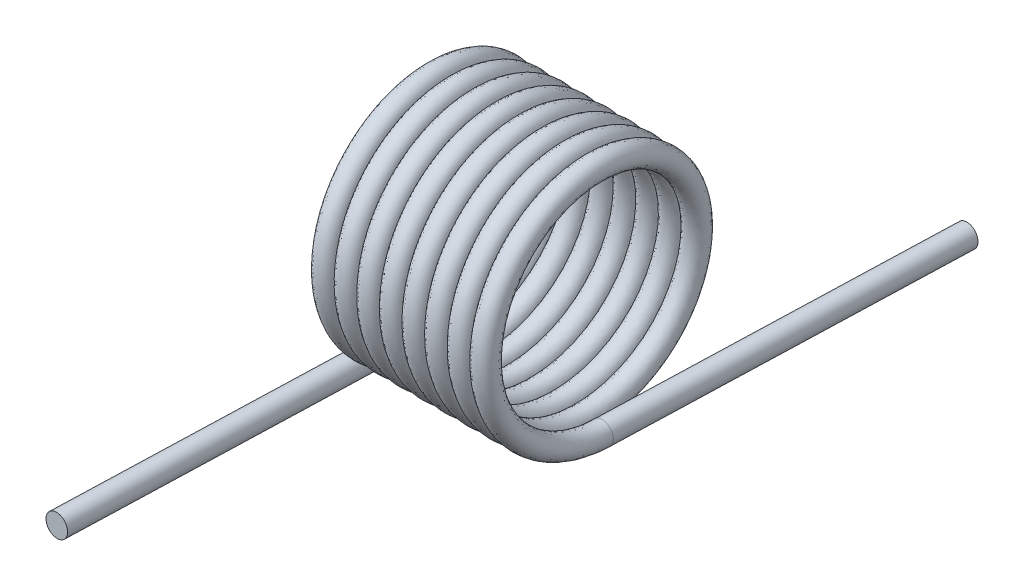
from build123d import *

# Parameters (mm, degrees)
SWEEP1_PITCH   = 2.4384
SKETCH3_R      = 1.2065
EXTRUDE1_DEPTH = 38.1
SKETCH4_R      = 1.2065
EXTRUDE2_DEPTH = 38.1


with BuildPart() as part:
    # Sweep1: the profile of Sketch2 screwed along a right-hand helix of 8 turns, 6 arcs to a turn; built about Z, then put on its axis
    sweep1_z = Axis((0, 0, 0), (0, 0, 1))
    sweep1_corners = [(11.9761, 0.039075909, -1.205867042), (10.7696, 0, 0), (11.9761, -0.039075909, 1.205867042), (13.1826, 0, 0)]
    with BuildLine(mode=Mode.PRIVATE) as sweep1_profile:
        ThreePointArc((11.9761, 0.039075909, -1.205867042), (11.122975668, 0.02763084, -0.852676763), (10.7696, 0, 0))
        ThreePointArc((10.7696, 0, 0), (11.122975668, -0.02763084, 0.852676763), (11.9761, -0.039075909, 1.205867042))
        ThreePointArc((11.9761, -0.039075909, 1.205867042), (12.829224332, -0.02763084, 0.852676763), (13.1826, 0, 0))
        ThreePointArc((13.1826, 0, 0), (12.829224332, 0.02763084, -0.852676763), (11.9761, 0.039075909, -1.205867042))
    sweep1_cap = Face(sweep1_profile.wire())
    sweep1_arcs = [((11.9761, 0.039075909, -1.205867042), (10.7696, 0.039075909, -1.205867042), (10.7696, 0, 0), (1, 0.7071067811865476, 1)), ((10.7696, 0, 0), (10.7696, -0.039075909, 1.205867042), (11.9761, -0.039075909, 1.205867042), (1, 0.7071067811865476, 1)), ((11.9761, -0.039075909, 1.205867042), (13.1826, -0.039075909, 1.205867042), (13.1826, 0, 0), (1, 0.7071067811865476, 1)), ((13.1826, 0, 0), (13.1826, 0.039075909, -1.205867042), (11.9761, 0.039075909, -1.205867042), (1, 0.7071067811865476, 1))]  # start, shoulder, end, weights
    sweep1_turn_angles = [0, 30, 60, 90, 120, 150, 180, 210, 240, 270, 300, 330, 360]
    sweep1_turn_weights = [1, 0.8660254037844387, 1, 0.8660254037844387, 1, 0.8660254037844387, 1, 0.8660254037844387, 1, 0.8660254037844387, 1, 0.8660254037844387, 1]
    sweep1_turn_sides = [Face.make_bezier_surface([[Vector(p[j][0], p[j][1], 0).rotate(sweep1_z, sweep1_turn_angles[2 * i + k]) / sweep1_turn_weights[2 * i + k] + Vector(0, 0, p[j][2] + SWEEP1_PITCH * sweep1_turn_angles[2 * i + k] / 360) for k in range(3)] for j in range(3)], [[p[3][j] * sweep1_turn_weights[2 * i + k] for k in range(3)] for j in range(3)]) for p in sweep1_arcs for i in range(6)]
    sweep1 = Plane(origin=(0, 0, 0), x_dir=(0, -1, 0), z_dir=(1, 0, 0)) * Solid(Shell([*[p.moved(Location((0, 0, SWEEP1_PITCH * i))) for i in range(8) for p in sweep1_turn_sides], sweep1_cap, sweep1_cap.rotate(sweep1_z, 2880).moved(Location((0, 0, SWEEP1_PITCH * 2880 / 360)))]))
    add(sweep1)

    # Sketch3 → Extrude1 (add)
    with BuildSketch(Plane(origin=(0, 0, 0), x_dir=(0.9994753768225241, -2.6712355621968785e-14, 0.03238782372240541), z_dir=(-0.03238782372240541, -1.0018023229831609e-14, 0.9994753768225241))):
        with Locations(Location((0, -11.9761, 0), (0, 0, 180))):
            Circle(SKETCH3_R)
    extrude(amount=EXTRUDE1_DEPTH)

    # Sketch4 → Extrude2 (add)
    with BuildSketch(Plane(origin=(0.02046249, 0, -0.6314643), x_dir=(-0.9958066104404693, -0.08560321398081558, -0.0322689379933462), z_dir=(0.03238782372240541, 1.2168651503108308e-13, -0.9994753768225242))):
        with Locations(Location((-18.40020606, -13.601142383, 0), (0, 0, 4.910712917))):
            Circle(SKETCH4_R)
    extrude(amount=EXTRUDE2_DEPTH)


solid = part.part
